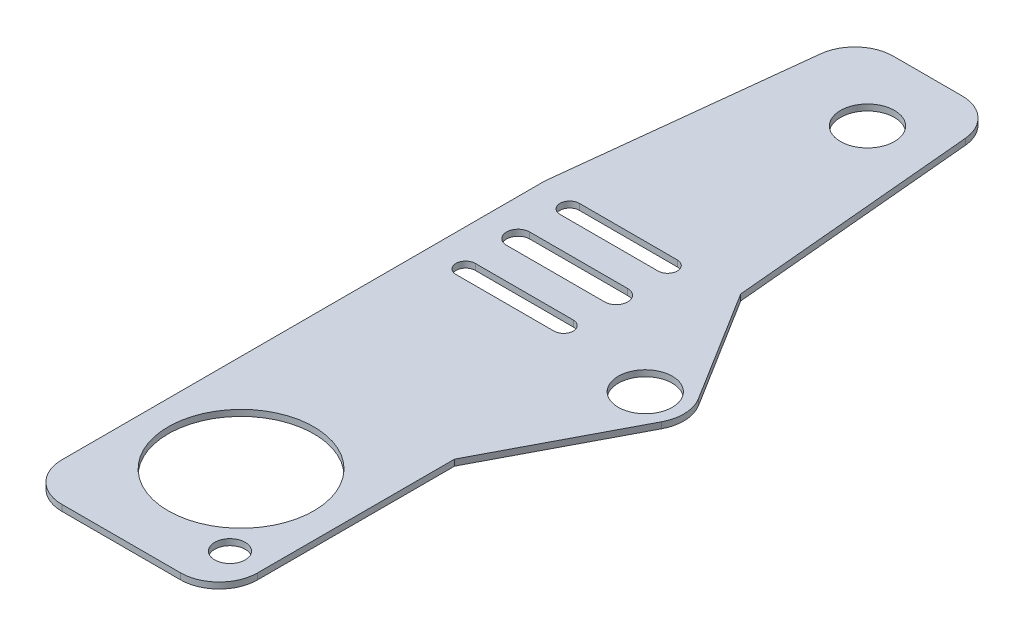
from build123d import *

# Parameters (mm, degrees)
SKETCH1_R           = 18.9
SKETCH1_R_2         = 3.960069723
SKETCH1_R_3         = 2.875
SKETCH1_R_4         = 7
BOSS_EXTRUDE1_DEPTH = 1.5875
SKETCH4_W           = 66.272407177
SKETCH4_H           = 27.800260981
CUT_EXTRUDE2_DEPTH  = 20
FILLET3_R           = 10
FILLET4_R           = 10
BOSS_EXTRUDE3_START = -1.5875
BOSS_EXTRUDE3_DEPTH = 1.5875
SKETCH7_R           = 7
CUT_EXTRUDE3_DEPTH  = 1.5875
CUT_EXTRUDE4_DEPTH  = 10


with BuildPart() as part:
    # Sketch1 → Boss-Extrude1 (new body)
    with BuildSketch(Plane(origin=(0, 0, 0), x_dir=(1, 0, 0), z_dir=(0, 1, 0))):
        with BuildLine():
            Line((42.32729629, 228.6), (10.454309325, 228.6))
            Line((10.454309325, 228.6), (0, 135.362739137))
            Line((0, 135.362739137), (0, 0))
            Line((0, 0), (24.327009544, 0))
            Line((24.327009544, 0), (50.8, 0))
            Line((50.8, 0), (50.8, 64.87909603))
            Line((50.8, 64.87909603), (50.8, 87.423477361))
            Line((50.8, 87.423477361), (50.8, 98.200996728))
            ThreePointArc((50.8, 98.200996728), (50.4, 101.000996728), (50.8, 103.800996728))
            Line((50.8, 103.800996728), (50.8, 104.488200565))
            Line((50.8, 104.488200565), (50.8, 120.619222808))
            Line((50.8, 120.619222808), (50.8, 135.362739137))
            Line((50.8, 135.362739137), (42.32729629, 228.6))
        make_face()
        with Locations((25.271589382, 31.225922091)):
            Circle(SKETCH1_R, mode=Mode.SUBTRACT)
        with Locations((42.32729629, 11.29561028)):
            Circle(SKETCH1_R_2, mode=Mode.SUBTRACT)
        with Locations((24.101759227, 118.784935242)):
            Circle(SKETCH1_R_3, mode=Mode.SUBTRACT)
        with Locations((29.504213454, 189.557234372)):
            Circle(SKETCH1_R_4, mode=Mode.SUBTRACT)
    extrude(amount=BOSS_EXTRUDE1_DEPTH)

    # Sketch4 → Cut-Extrude2 (cut)
    with BuildSketch(Plane(origin=(0, 0, -228.6), x_dir=(-1, 0, 0), z_dir=(0, 0, -1))):
        with Locations((-28.174690156, -1.980940155)):
            Rectangle(SKETCH4_W, SKETCH4_H)
    extrude(amount=-CUT_EXTRUDE2_DEPTH, mode=Mode.SUBTRACT)

    # Fillet3
    fillet3_edges = [part.edges().sort_by_distance(p)[0] for p in [
        (44.144746445, 0.79375, -208.6),
    ]]
    fillet(fillet3_edges, radius=FILLET3_R)

    # Fillet4
    fillet4_edges = [part.edges().sort_by_distance(p)[0] for p in [
        (50.8, 0.79375, 0),
        (0, 0.79375, 0),
        (8.211791854, 0.79375, -208.6),
    ]]
    fillet(fillet4_edges, radius=FILLET4_R)

    # Sketch6 → Boss-Extrude3 (add)
    with BuildSketch(Plane(origin=(0, 1.5875, 0), x_dir=(1, 0, 0), z_dir=(0, 1, 0)).offset(BOSS_EXTRUDE3_START)):
        with BuildLine():
            Line((50.8, 135.362739137), (50.8, 103.800996728))
            ThreePointArc((50.8, 103.800996728), (50.4, 101.000996728), (50.8, 98.200996728))
            Line((50.8, 98.200996728), (50.8, 61.124243317))
            Line((50.8, 61.124243317), (69.258211507, 96.360728536))
            ThreePointArc((69.258211507, 96.360728536), (70.393157133, 101.370875786), (68.890940865, 106.283413148))
            Line((68.890940865, 106.283413148), (50.8, 135.362739137))
        make_face()
    extrude(amount=BOSS_EXTRUDE3_DEPTH)

    # Sketch7 → Cut-Extrude3 (cut)
    with BuildSketch(Plane(origin=(0, 1.5875, 0), x_dir=(1, 0, 0), z_dir=(0, 1, 0))):
        with Locations((60.4, 101.000996728)):
            Circle(SKETCH7_R)
    extrude(amount=-CUT_EXTRUDE3_DEPTH, mode=Mode.SUBTRACT)

    # Sketch8 → Cut-Extrude4 (cut)
    with BuildSketch(Plane(origin=(0, 1.5875, 0), x_dir=(1, 0, 0), z_dir=(0, 1, 0))):
        with BuildLine():
            Line((34.925740903, 121.909935242), (9.492033273, 121.909935242))
            ThreePointArc((9.492033273, 121.909935242), (6.492033273, 118.909935242), (9.492033273, 115.909935242))
            Line((9.492033273, 115.909935242), (34.925740903, 115.909935242))
            ThreePointArc((34.925740903, 115.909935242), (37.925740903, 118.909935242), (34.925740903, 121.909935242))
        make_face()
        with BuildLine():
            Line((23.38035776, 134.784935242), (9.492033273, 134.784935242))
            ThreePointArc((9.492033273, 134.784935242), (6.992033273, 132.284935242), (9.492033273, 129.784935242))
            Line((9.492033273, 129.784935242), (23.38035776, 129.784935242))
            ThreePointArc((23.38035776, 129.784935242), (20.88035776, 132.284935242), (23.38035776, 134.784935242))
        make_face()
        with BuildLine():
            Line((34.925740903, 134.784935242), (23.38035776, 134.784935242))
            ThreePointArc((23.38035776, 134.784935242), (25.88035776, 132.284935242), (23.38035776, 129.784935242))
            Line((23.38035776, 129.784935242), (34.925740903, 129.784935242))
            ThreePointArc((34.925740903, 129.784935242), (37.425740903, 132.284935242), (34.925740903, 134.784935242))
        make_face()
        with BuildLine():
            ThreePointArc((9.492033273, 107.784935242), (6.992033273, 105.284935242), (9.492033273, 102.784935242))
            Line((9.492033273, 102.784935242), (34.925740903, 102.784935242))
            ThreePointArc((34.925740903, 102.784935242), (37.425740903, 105.284935242), (34.925740903, 107.784935242))
            Line((34.925740903, 107.784935242), (9.492033273, 107.784935242))
        make_face()
    extrude(amount=-CUT_EXTRUDE4_DEPTH, mode=Mode.SUBTRACT)


with BuildPart() as cut_extrude4_kept_piece:
    # of the separate pieces the step leaves, the one the design keeps (cut_extrude4_pieces_kept)
    add(part.part.solids().sort_by_distance((17.153197832, 0, -208.6))[0])


solid = cut_extrude4_kept_piece.part
